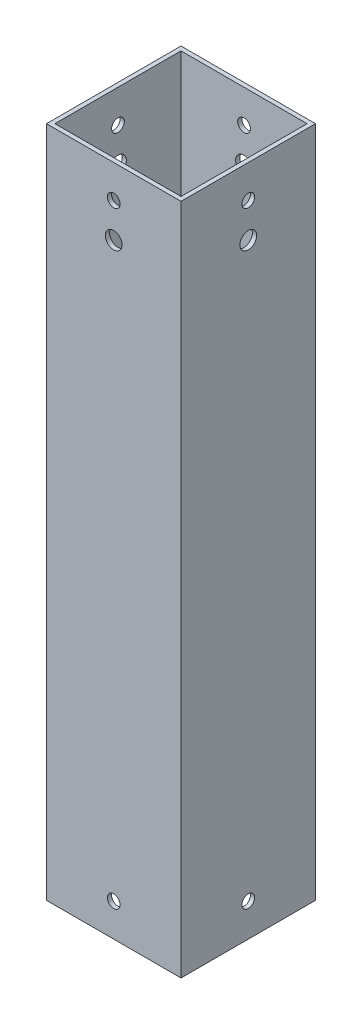
from build123d import *

# Parameters (mm, degrees)
SKETCH1_W               = 50.8
SKETCH1_H               = 50.8
SKETCH1_W_2             = 47.625
SKETCH1_H_2             = 47.625
BOSS_EXTRUDE1_DEPTH     = 254
CUT_EXTRUDE1_DEPTH      = 260.967363637
CUT_EXTRUDE1_DEPTH_BACK = 260.967363637
SKETCH4_R               = 2.3999952
SKETCH5_R               = 2.3999952
CUT_EXTRUDE2_DEPTH      = 261.272549455
CUT_EXTRUDE3_DEPTH      = 261.272549455
CUT_EXTRUDE3_DEPTH_BACK = 261.272549455
SKETCH6_R               = 2.3999952
CUT_EXTRUDE4_DEPTH      = 261.272549455
CUT_EXTRUDE4_DEPTH_BACK = 261.272549455
SKETCH7_R               = 2.3999952
CUT_EXTRUDE5_DEPTH      = 261.272549455
CUT_EXTRUDE5_DEPTH_BACK = 261.272549455
SKETCH8_R               = 3.175
CUT_EXTRUDE6_DEPTH      = 261.272549455
CUT_EXTRUDE6_DEPTH_BACK = 261.272549455
SKETCH9_R               = 3.175


with BuildPart() as part:
    # Sketch1 → Boss-Extrude1 (new body)
    with BuildSketch(Plane(origin=(0, 0, 0), x_dir=(1, 0, 0), z_dir=(0, 1, 0))):
        Rectangle(SKETCH1_W, SKETCH1_H)
        Rectangle(SKETCH1_W_2, SKETCH1_H_2, mode=Mode.SUBTRACT)
    extrude(amount=BOSS_EXTRUDE1_DEPTH)

    # Sketch4 → Cut-Extrude1 (cut, two sides: drawn at the far end of the back side and taken through both)
    with BuildSketch(Plane(origin=(-23.8125, 0, 0), x_dir=(0, 0, -1), z_dir=(1, 0, 0)).offset(-CUT_EXTRUDE1_DEPTH_BACK)):
        with Locations((0, 241.587599882)):
            Circle(SKETCH4_R)
    extrude(amount=CUT_EXTRUDE1_DEPTH + CUT_EXTRUDE1_DEPTH_BACK, mode=Mode.SUBTRACT)

    # Sketch5 → Cut-Extrude2 (cut, through all)
    with BuildSketch(Plane(origin=(0, 0, -25.4), x_dir=(-1, 0, 0), z_dir=(0, 0, -1))):
        with Locations((0, 241.587599882)):
            Circle(SKETCH5_R)
    extrude(amount=-CUT_EXTRUDE2_DEPTH, mode=Mode.SUBTRACT)

    # Sketch6 → Cut-Extrude3 (cut, two sides: drawn at the far end of the back side and taken through both)
    with BuildSketch(Plane(origin=(25.4, 0, 0), x_dir=(0, 0, -1), z_dir=(1, 0, 0)).offset(-CUT_EXTRUDE3_DEPTH_BACK)):
        with Locations((0, 12.412400118)):
            Circle(SKETCH6_R)
    extrude(amount=CUT_EXTRUDE3_DEPTH + CUT_EXTRUDE3_DEPTH_BACK, mode=Mode.SUBTRACT)

    # Sketch7 → Cut-Extrude4 (cut, two sides: drawn at the far end of the back side and taken through both)
    with BuildSketch(Plane(origin=(0, 0, -25.4), x_dir=(-1, 0, 0), z_dir=(0, 0, -1)).offset(-CUT_EXTRUDE4_DEPTH_BACK)):
        with Locations((0, 12.412400118)):
            Circle(SKETCH7_R)
    extrude(amount=CUT_EXTRUDE4_DEPTH + CUT_EXTRUDE4_DEPTH_BACK, mode=Mode.SUBTRACT)

    # Sketch8 → Cut-Extrude5 (cut, two sides: drawn at the far end of the back side and taken through both)
    with BuildSketch(Plane(origin=(0, 0, -25.4), x_dir=(-1, 0, 0), z_dir=(0, 0, -1)).offset(-CUT_EXTRUDE5_DEPTH_BACK)):
        with Locations((0, 228.6)):
            Circle(SKETCH8_R)
    extrude(amount=CUT_EXTRUDE5_DEPTH + CUT_EXTRUDE5_DEPTH_BACK, mode=Mode.SUBTRACT)

    # Sketch9 → Cut-Extrude6 (cut, two sides: drawn at the far end of the back side and taken through both)
    with BuildSketch(Plane(origin=(25.4, 0, 0), x_dir=(0, 0, -1), z_dir=(1, 0, 0)).offset(-CUT_EXTRUDE6_DEPTH_BACK)):
        with Locations((0, 228.6)):
            Circle(SKETCH9_R)
    extrude(amount=CUT_EXTRUDE6_DEPTH + CUT_EXTRUDE6_DEPTH_BACK, mode=Mode.SUBTRACT)


solid = part.part
